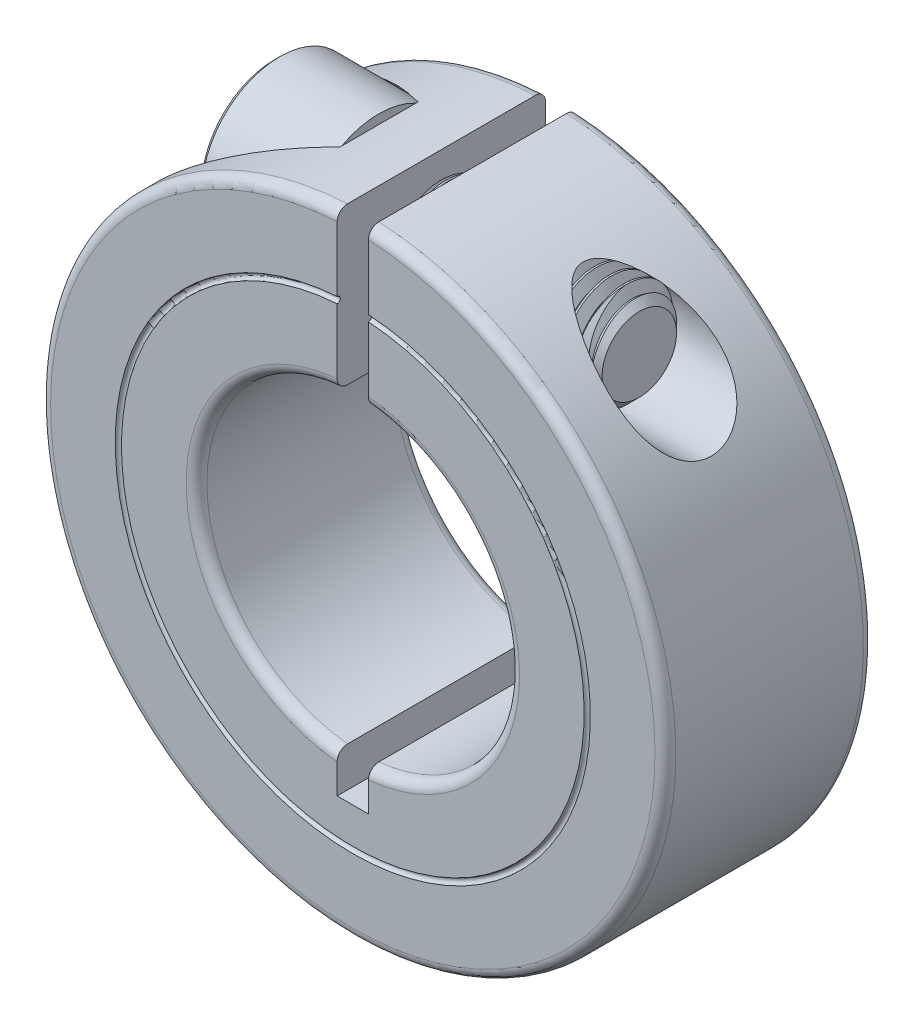
from build123d import *

# Parameters (mm, degrees)
EXTRUDE1_DEPTH     = 6.35
FILLET1_R          = 0.635
CUT_EXTRUDE1_DEPTH = 4.7625
CHAMFER1_SIZE      = 0.3175
CHAMFER2_SIZE      = 0.907142857
CUT_SWEEP1_PITCH   = 0.907142857


with BuildPart() as part:
    # Sketch1 → Extrude1 (new, symmetric)
    with BuildSketch(Plane.XY):
        with BuildLine():
            Line((-0.9525, 9.477255338), (-0.9525, 19.026172599))
            ThreePointArc((-0.9525, 19.026172599), (0, -19.05), (0.9525, 19.026172599))
            Line((0.9525, 19.026172599), (0.9525, 9.477255338))
            ThreePointArc((0.9525, 9.477255338), (9.525, 0), (0.9525, -9.477255338))
            Line((0.9525, -9.477255338), (0.9525, -11.90625))
            Line((0.9525, -11.90625), (-0.9525, -11.90625))
            Line((-0.9525, -11.90625), (-0.9525, -9.477255338))
            ThreePointArc((-0.9525, -9.477255338), (-9.525, 0), (-0.9525, 9.477255338))
        make_face()
    extrude(amount=EXTRUDE1_DEPTH, both=True)

    # Fillet1
    fillet1_edges = [part.edges().sort_by_distance(p)[0] for p in [
        (-9.525, 0, 6.35),
        (0, -19.05, 6.35),
        (9.525, 0, 6.35),
        (9.525, 0, -6.35),
        (0, -19.05, -6.35),
        (-9.525, 0, -6.35),
    ]]
    fillet(fillet1_edges, radius=FILLET1_R)

    # Sketch2 → Cut-Revolve1 (revolve, cut)
    with BuildSketch(Plane(origin=(0, 0, 0), x_dir=(1, 0, 0), z_dir=(0, 1, 0))):
        with BuildLine():
            Line((-14.478, -6.35), (-14.097, -6.35))
            ThreePointArc((-14.097, -6.35), (-14.2875, -6.1595), (-14.478, -6.35))
        make_face()
    revolve(axis=Axis((0, 0, -6.35), (0, 0, 1)), mode=Mode.SUBTRACT)

    # Sketch3 → Cut-Revolve2 (revolve, cut)
    with BuildSketch(Plane.XY, mode=Mode.PRIVATE) as cut_revolve2_sk:
        Polygon((19.05, 14.251713968), (-19.05, 14.251713968), (-19.05, 9.425713968), (-4.7625, 9.425713968), (-4.7625, 11.076713968), (19.05, 11.076713968), align=None)
    revolve(cut_revolve2_sk.sketch.rotate(Axis((-19.05, 14.251713968, 0), (-1, 0, 0)), 270), axis=Axis((-19.05, 14.251713968, 0), (-1, 0, 0)), mode=Mode.SUBTRACT)


with BuildPart() as body_2:
    # Sketch4 → Revolve1 (revolve)
    with BuildSketch(Plane.XY):
        Polygon((-11.1125, 14.251713968), (-11.1125, 19.014213968), (-4.7625, 19.014213968), (-4.7625, 17.426713968), (11.1125, 17.426713968), (11.1125, 14.251713968), align=None)
    revolve(axis=Axis((11.1125, 14.251713968, 0), (-1, 0, 0)))

    # Sketch5 → Cut-Extrude1 (cut)
    with BuildSketch(Plane(origin=(-11.1125, 0, 0), x_dir=(0, -1, 0), z_dir=(-1, 0, 0))):
        Polygon((-12.87689864, -2.38125), (-11.502083311, 0), (-12.87689864, 2.38125), (-15.626529297, 2.38125), (-17.001344626, 0), (-15.626529297, -2.38125), align=None)
    extrude(amount=-CUT_EXTRUDE1_DEPTH, mode=Mode.SUBTRACT)

    # Chamfer1
    chamfer1_edges = [body_2.edges().sort_by_distance(p)[0] for p in [
        (-11.1125, 9.489213968, 0),
    ]]
    chamfer(chamfer1_edges, length=CHAMFER1_SIZE)

    # Chamfer2
    chamfer2_edges = [body_2.edges().sort_by_distance(p)[0] for p in [
        (11.1125, 11.076713968, 0),
    ]]
    chamfer(chamfer2_edges, length=CHAMFER2_SIZE)

    # Cut-Sweep1: arcs per turn and ends read off the stored shape
    # Cut-Sweep1: the profile of Sketch7 screwed along a right-hand helix through 17.5 turns, 8 arcs to a turn; built about Z, then put on its axis
    cut_sweep1_z = Axis((0, 0, 0), (0, 0, 1))
    cut_sweep1_corners = [(2.585793431, -4.51e-07, -0.566964311), (2.585793431, -4.51e-07, -0.680357168), (3.224100547, -5.63e-07, -1.048883954), (3.224100547, -5.63e-07, -0.198437525)]
    with BuildLine(mode=Mode.PRIVATE) as cut_sweep1_profile:
        Line(cut_sweep1_corners[0], cut_sweep1_corners[1])
        Line(cut_sweep1_corners[1], cut_sweep1_corners[2])
        Line(cut_sweep1_corners[2], cut_sweep1_corners[3])
        Line(cut_sweep1_corners[3], cut_sweep1_corners[0])
    cut_sweep1_cap = Face(cut_sweep1_profile.wire())
    cut_sweep1_turn_angles = [0, 22.5, 45, 67.5, 90, 112.5, 135, 157.5, 180, 202.5, 225, 247.5, 270, 292.5, 315, 337.5, 360]
    cut_sweep1_turn_weights = [1, 0.9238795325112867, 1, 0.9238795325112867, 1, 0.9238795325112867, 1, 0.9238795325112867, 1, 0.9238795325112867, 1, 0.9238795325112867, 1, 0.9238795325112867, 1, 0.9238795325112867, 1]
    cut_sweep1_turn_rails = [Edge.make_bspline([Vector(p[0], p[1], 0).rotate(cut_sweep1_z, cut_sweep1_turn_angles[k]) / cut_sweep1_turn_weights[k] + Vector(0, 0, p[2] + CUT_SWEEP1_PITCH * cut_sweep1_turn_angles[k] / 360) for k in range(17)], [0, 0, 0, 1, 1, 2, 2, 3, 3, 4, 4, 5, 5, 6, 6, 7, 7, 8, 8, 8], 2, cut_sweep1_turn_weights) for p in cut_sweep1_corners]
    cut_sweep1_turn_sides = [Face.make_surface_from_curves(cut_sweep1_turn_rails[p[0]], cut_sweep1_turn_rails[p[1]]) for p in [(0, 1), (1, 2), (2, 3), (3, 0)]]
    cut_sweep1_last_angles = [6120, 6142.5, 6165, 6187.5, 6210, 6232.5, 6255, 6277.5, 6300]
    cut_sweep1_last_weights = [1, 0.9238795325112867, 1, 0.9238795325112867, 1, 0.9238795325112867, 1, 0.9238795325111319, 1]
    cut_sweep1_last_rails = [Edge.make_bspline([Vector(p[0], p[1], 0).rotate(cut_sweep1_z, cut_sweep1_last_angles[k]) / cut_sweep1_last_weights[k] + Vector(0, 0, p[2] + CUT_SWEEP1_PITCH * cut_sweep1_last_angles[k] / 360) for k in range(9)], [0, 0, 0, 1, 1, 2, 2, 3, 3, 4, 4, 4], 2, cut_sweep1_last_weights) for p in cut_sweep1_corners]
    cut_sweep1_last_sides = [Face.make_surface_from_curves(cut_sweep1_last_rails[p[0]], cut_sweep1_last_rails[p[1]]) for p in [(0, 1), (1, 2), (2, 3), (3, 0)]]
    cut_sweep1 = Plane(origin=(11.1125, 14.251713968, 0), x_dir=(0, 0, 1), z_dir=(-1, 0, 0)) * Solid(Shell([*[p.moved(Location((0, 0, CUT_SWEEP1_PITCH * i))) for i in range(17) for p in cut_sweep1_turn_sides], *cut_sweep1_last_sides, cut_sweep1_cap, cut_sweep1_cap.rotate(cut_sweep1_z, 6300).moved(Location((0, 0, CUT_SWEEP1_PITCH * 6300 / 360)))]))
    add(cut_sweep1, mode=Mode.SUBTRACT)


solid = Compound([part.part, body_2.part])
